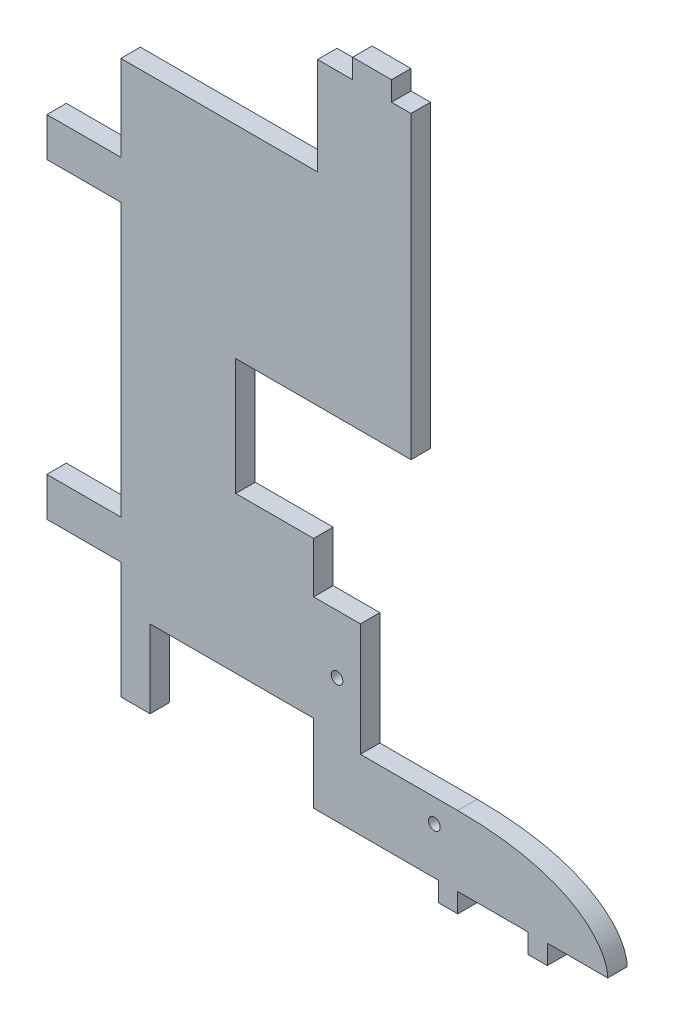
from build123d import *

# Parameters (mm, degrees)
ESQUISSE1_R        = 1.5
BOSS_EXTRU_1_DEPTH = 5
BOSS_EXTRU_2_DEPTH = 5


with BuildPart() as part:
    # Esquisse1 → Boss.-Extru.1 (new body)
    with BuildSketch(Plane.XY):
        Polygon((0, 0), (32, 0), (32, -5), (37, -5), (37, 0), (37, 18), (12, 18), (12, 47), (0, 47), align=None)
        with Locations((6, 32)):
            Circle(ESQUISSE1_R, mode=Mode.SUBTRACT)
        with Locations((31, 12)):
            Circle(ESQUISSE1_R, mode=Mode.SUBTRACT)
    extrude(amount=BOSS_EXTRU_1_DEPTH)

    # Esquisse2 → Boss.-Extru.2 (add)
    with BuildSketch(Plane(origin=(0, 0, 0), x_dir=(-1, 0, 0), z_dir=(0, 0, -1))):
        with BuildLine():
            Line((-37, 0), (-55, 0))
            Line((-55, 0), (-55, -5))
            Line((-55, -5), (-60, -5))
            Line((-60, -5), (-60, 0))
            Line((-60, 0), (-75.5, 0))
            add(Edge.make_bspline(
                [(-75.5, 0), (-75.5, 5.982232529), (-67.685409636, 18), (-37, 18)],
                knots=[0, 0, 0, 0, 1, 1, 1, 1], degree=3))
            Line((-37, 18), (-37, 0))
        make_face()
        Polygon((42, 0), (49.5, 0), (49.5, 30), (68.5, 30), (68.5, 40), (49.5, 40), (49.5, 110), (68.5, 110), (68.5, 120), (49.5, 120), (49.5, 142), (-1, 142), (-1, 167), (-10, 167), (-10, 172), (-20, 172), (-20, 167), (-25, 167), (-25, 90), (20, 90), (20, 60), (0, 60), (0, 20), (42, 20), align=None)
    extrude(amount=-BOSS_EXTRU_2_DEPTH)


solid = part.part
